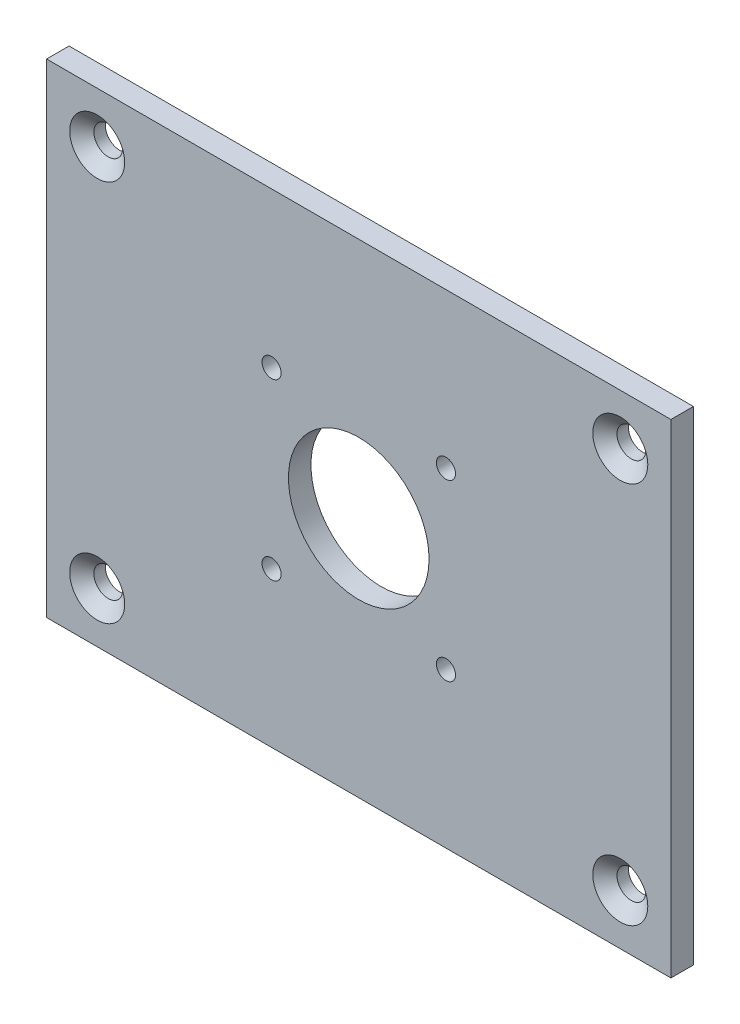
from build123d import *

# Parameters (mm, degrees)
SKETCH1_W                          = 111
SKETCH1_H                          = 86
BASE_DEPTH                         = 4
NEMA_17_SCREW_HOLE_PATTERN_D       = 3.4
SKETCH5_R                          = 12.5
MOTOR_SHAFT_CLEAREANCE_DEPTH       = 141.474196919
WOOD_SCREW_HOLE_PATTERN_AT_2_COUNT = 2
WOOD_SCREW_HOLE_PATTERN_AT_2_PITCH = 115.20850663
WOOD_SCREW_HOLE_PATTERN_AT_3_COUNT = 2
WOOD_SCREW_HOLE_PATTERN_AT_3_PITCH = 68
WOOD_SCREW_HOLE_PATTERN_AT_4_COUNT = 2
WOOD_SCREW_HOLE_PATTERN_AT_4_PITCH = 93


with BuildPart() as part:
    # Sketch1 → base (new body)
    with BuildSketch(Plane.XY):
        with Locations((55.5, 43)):
            Rectangle(SKETCH1_W, SKETCH1_H)
    extrude(amount=BASE_DEPTH)

    # nema 17 screw hole pattern (through all)
    with Locations(Plane.XY.offset(4)):
        with Locations((40, 58.5), (71, 27.5), (40, 27.5), (71, 58.5)):
            Hole(NEMA_17_SCREW_HOLE_PATTERN_D / 2)

    # Sketch5 → motor shaft cleareance (cut, through all)
    with BuildSketch(Plane.XY.offset(4)):
        with Locations((55.5, 43)):
            Circle(SKETCH5_R)
    extrude(amount=-MOTOR_SHAFT_CLEAREANCE_DEPTH, mode=Mode.SUBTRACT)

    # Sketch7 → wood screw hole pattern (revolve, cut)
    with BuildSketch(Plane(origin=(9, 77, 4), x_dir=(0, -1, 0), z_dir=(1, 0, 0))):
        Polygon((0, 0), (0, 4), (2.5527, 4), (2.5527, 1.960808018), (4.8895, 0), align=None)
    wood_screw_hole_pattern = revolve(axis=Axis((9, 77, 10.35), (0, 0, -1)), mode=Mode.SUBTRACT)

    # wood screw hole pattern at 2: wood screw hole pattern ×2
    with Locations(*[Vector(0.8072320588129593, -0.5902341935406581, 0) * (i * WOOD_SCREW_HOLE_PATTERN_AT_2_PITCH) for i in range(1, WOOD_SCREW_HOLE_PATTERN_AT_2_COUNT)]):
        add(wood_screw_hole_pattern, mode=Mode.SUBTRACT)

    # wood screw hole pattern at 3: wood screw hole pattern ×2
    with Locations(*[(0, -i * WOOD_SCREW_HOLE_PATTERN_AT_3_PITCH, 0) for i in range(1, WOOD_SCREW_HOLE_PATTERN_AT_3_COUNT)]):
        add(wood_screw_hole_pattern, mode=Mode.SUBTRACT)

    # wood screw hole pattern at 4: wood screw hole pattern ×2
    with Locations(*[(i * WOOD_SCREW_HOLE_PATTERN_AT_4_PITCH, 0, 0) for i in range(1, WOOD_SCREW_HOLE_PATTERN_AT_4_COUNT)]):
        add(wood_screw_hole_pattern, mode=Mode.SUBTRACT)


solid = part.part
